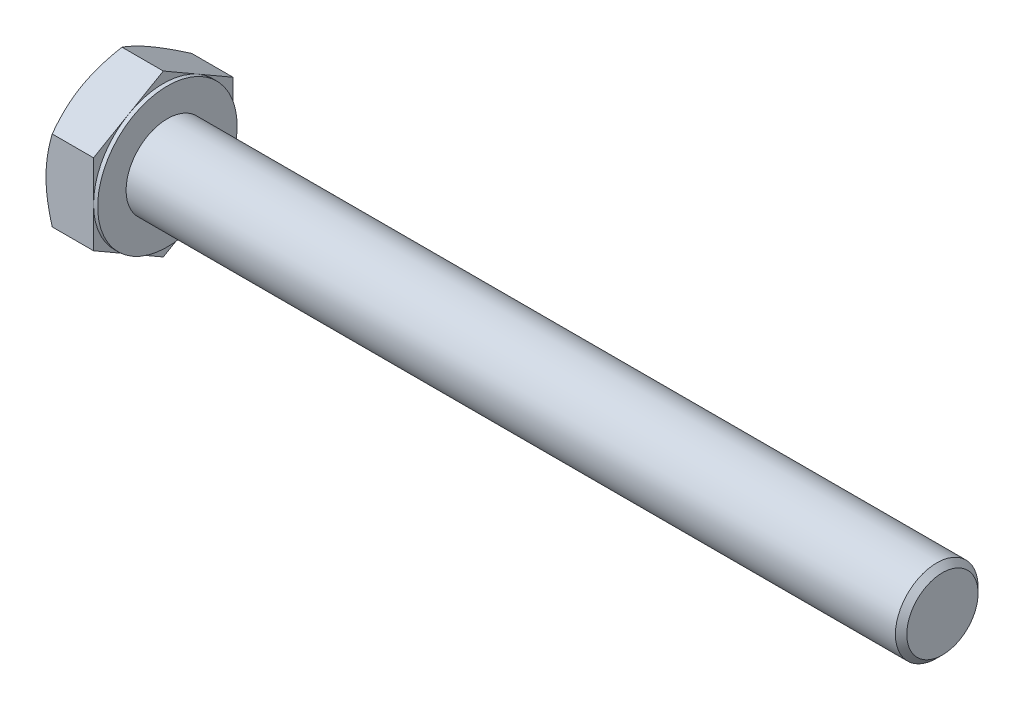
from build123d import *

# Parameters (mm, degrees)
BASEHEAD_DEPTH = 10
SKETCH4_W      = 0.8
SKETCH4_H      = 12.088457268


# Read off the part's stored shape, not the designer's step: HeadChamfer
with BuildPart() as part:
    # Sketch1 → BaseHead (new body)
    with BuildSketch(Plane(origin=(0, 0, 0), x_dir=(0, 0, -1), z_dir=(1, 0, 0))):
        Polygon((13.5, 7.794228634), (13.5, -7.794228634), (0, -15.588457268), (-13.5, -7.794228634), (-13.5, 7.794228634), (0, 15.588457268), align=None)
    extrude(amount=BASEHEAD_DEPTH)

    # HeadChamfer outline → HeadChamfer (revolve, cut)
    with BuildSketch(Plane.YX):
        Polygon((15.58845727, 1.205771367), (13.499999851, -8.6e-08), (15.58845727, -8.6e-08), align=None)
    revolve(axis=Axis((0, 0, 0), (1, 0, 0)), mode=Mode.SUBTRACT)

    # HeadChamfer 2 outline → HeadChamfer 2 (revolve)
    with BuildSketch(Plane.YX):
        Polygon((8, 10), (8, 158.8985), (6.8985, 160), (0, 160), (0, 10), align=None)
    revolve(axis=Axis((0, 0, 0), (1, 0, 0)))

    # Sketch4 → BearingFace (revolve, cut)
    with BuildSketch(Plane.XY, mode=Mode.PRIVATE) as bearingface_sk:
        with Locations((9.6, 19.544228634)):
            Rectangle(SKETCH4_W, SKETCH4_H)
    revolve(bearingface_sk.sketch.rotate(Axis((0, 0, 0), (1, 0, 0)), 90), axis=Axis((0, 0, 0), (1, 0, 0)), mode=Mode.SUBTRACT)


solid = part.part
